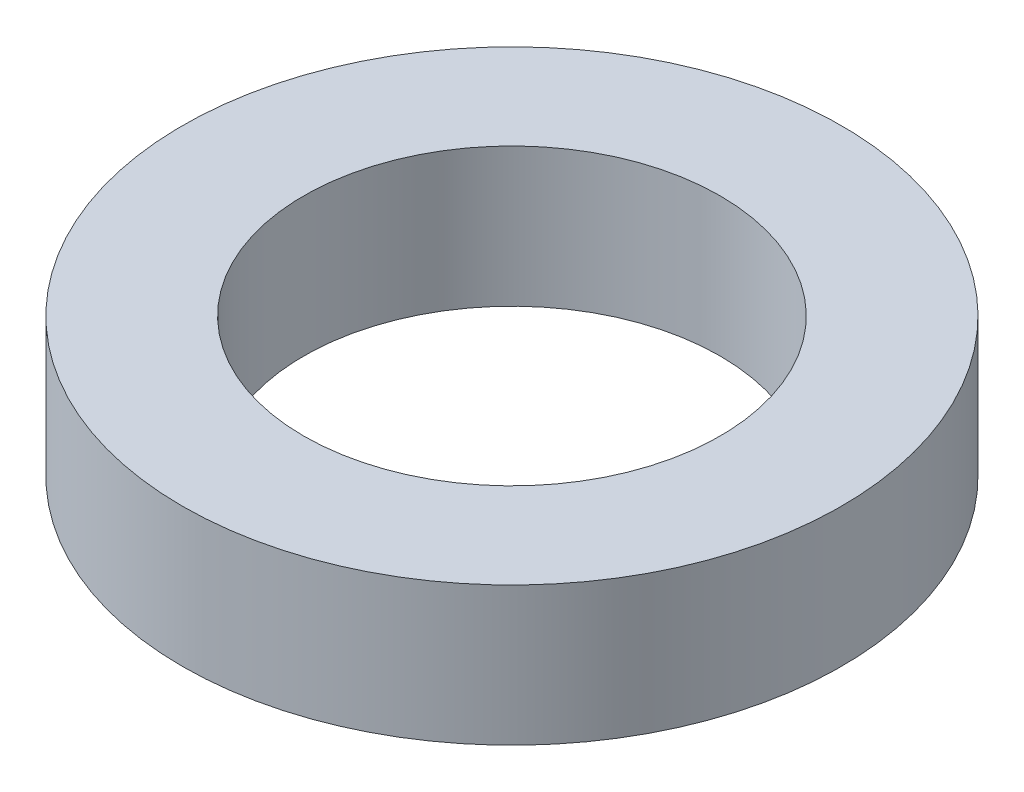
from build123d import *

# Parameters (mm, degrees)
SKETCH1_R           = 47.5
BOSS_EXTRUDE1_DEPTH = 20
SKETCH2_R           = 30
CUT_EXTRUDE1_DEPTH  = 71.089228844


with BuildPart() as part:
    # Sketch1 → Boss-Extrude1 (new body)
    with BuildSketch(Plane(origin=(0, 0, 0), x_dir=(1, 0, 0), z_dir=(0, 1, 0))):
        Circle(SKETCH1_R)
    extrude(amount=BOSS_EXTRUDE1_DEPTH)

    # Sketch2 → Cut-Extrude1 (cut, through all)
    with BuildSketch(Plane(origin=(0, 0, 0), x_dir=(1, 0, 0), z_dir=(0, 1, 0))):
        Circle(SKETCH2_R)
    extrude(amount=CUT_EXTRUDE1_DEPTH, mode=Mode.SUBTRACT)


solid = part.part
